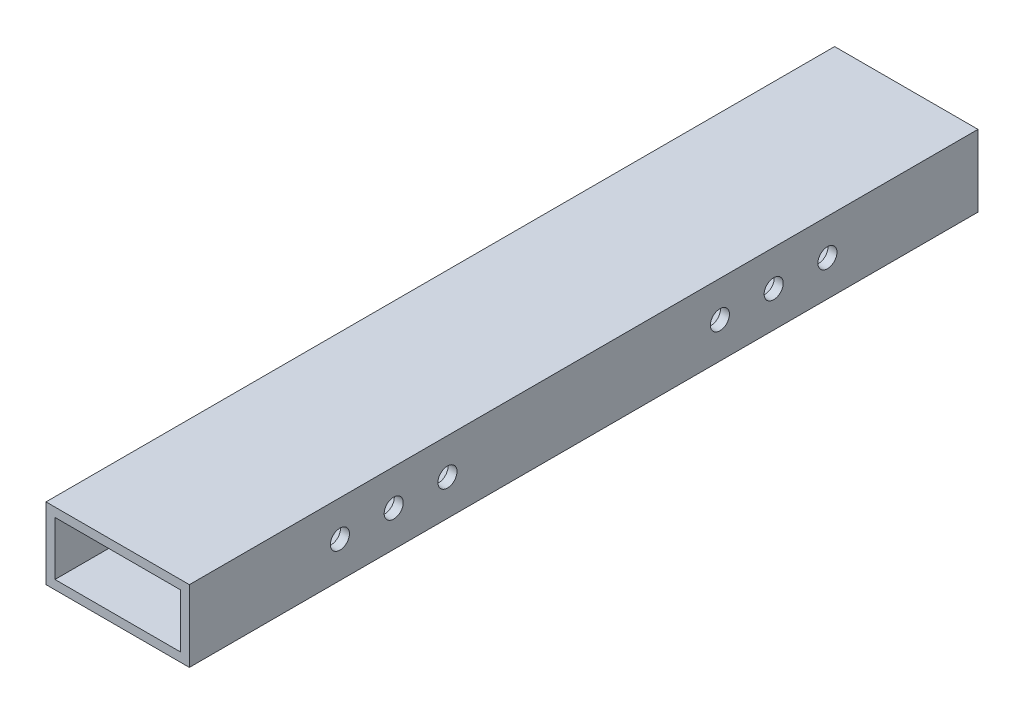
from build123d import *

# Parameters (mm, degrees)
SKETCH1_W           = 50.8
SKETCH1_H           = 25.4
SKETCH1_W_2         = 44.45
SKETCH1_H_2         = 19.05
BOSS_EXTRUDE1_DEPTH = 279.4
SKETCH2_R           = 3.3782
CUT_EXTRUDE1_DEPTH  = 286.114292872


with BuildPart() as part:
    # Sketch1 → Boss-Extrude1 (new body)
    with BuildSketch(Plane.XY):
        with Locations((25.4, 12.7)):
            Rectangle(SKETCH1_W, SKETCH1_H)
        with Locations((25.4, 12.7)):
            Rectangle(SKETCH1_W_2, SKETCH1_H_2, mode=Mode.SUBTRACT)
    extrude(amount=BOSS_EXTRUDE1_DEPTH)

    # Sketch2 → Cut-Extrude1 (cut, through all)
    with BuildSketch(Plane(origin=(50.8, 0, 0), x_dir=(0, 0, -1), z_dir=(1, 0, 0))):
        with Locations((-226.06, 12.7)):
            Circle(SKETCH2_R)
        with Locations((-187.96, 12.7)):
            Circle(SKETCH2_R)
        with Locations((-207.01, 12.7)):
            Circle(SKETCH2_R)
        with Locations((-91.44, 12.7)):
            Circle(SKETCH2_R)
        with Locations((-53.34, 12.7)):
            Circle(SKETCH2_R)
        with Locations((-72.39, 12.7)):
            Circle(SKETCH2_R)
    extrude(amount=-CUT_EXTRUDE1_DEPTH, mode=Mode.SUBTRACT)


solid = part.part
